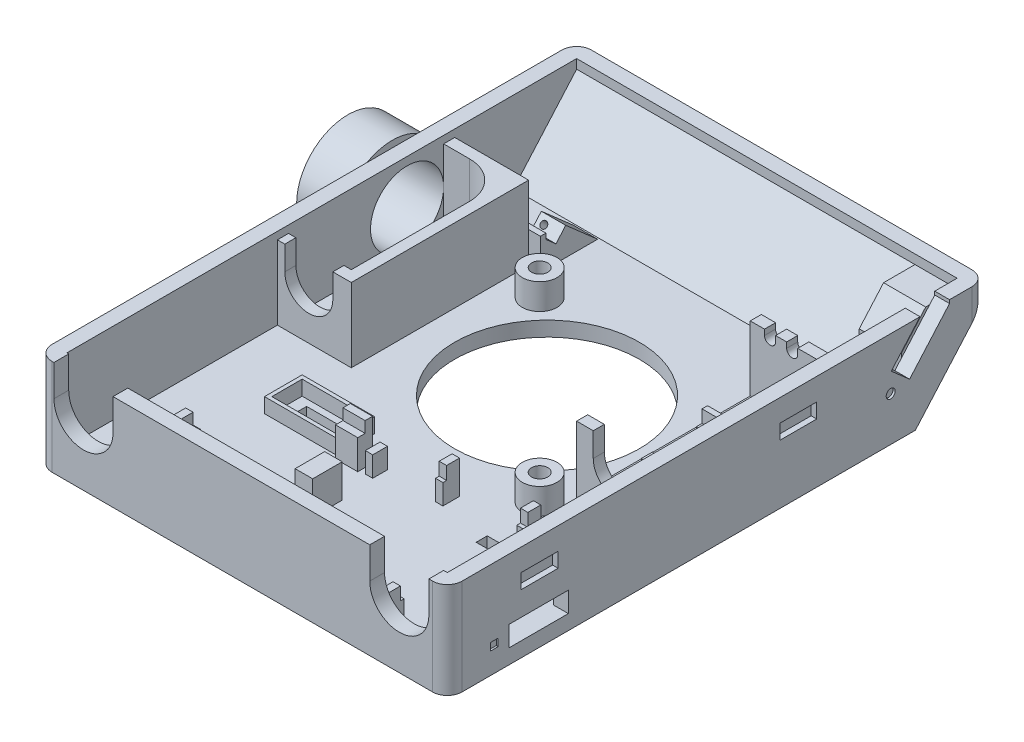
from build123d import *

# Parameters (mm, degrees)
SKETCH1_W            = 55.5
SKETCH1_H            = 73
BOSS_EXTRUDE1_DEPTH  = 13
CUT_EXTRUDE16_DEPTH  = 68.68677862
FILLET1_R            = 2
SHELL1_START         = -25.75
SHELL1_DEPTH         = 51.5
SKETCH3_W            = 10
SKETCH3_H            = 1.5
BOSS_EXTRUDE2_DEPTH  = 10
SKETCH4_W            = 1
SKETCH4_H            = 22
BOSS_EXTRUDE3_DEPTH  = 1.2
SKETCH5_R            = 2.35
SKETCH5_R_2          = 1.1
BOSS_EXTRUDE4_DEPTH  = 3.5
SKETCH8_W            = 1
SKETCH8_H            = 0.5
SKETCH8_H_2          = 2
BOSS_EXTRUDE7_DEPTH  = 2.75
SKETCH46_W           = 2.37743513
SKETCH46_H           = 4
SKETCH46_W_2         = 1
SKETCH46_H_2         = 1.75
BOSS_EXTRUDE24_DEPTH = 4.5
CUT_EXTRUDE1_DEPTH   = 10.1
SKETCH47_W           = 2
SKETCH47_H           = 1.5
CUT_EXTRUDE14_DEPTH  = 4.5
SKETCH14_W           = 3.4
SKETCH14_H           = 1.5
BOSS_EXTRUDE11_DEPTH = 5.05
SKETCH15_W           = 3.4
SKETCH15_H           = 0.75
BOSS_EXTRUDE12_DEPTH = 1.7
BOSS_EXTRUDE14_REACH = 49.395
CUT_EXTRUDE5_DEPTH   = 1.5
SKETCH22_R           = 4.95
CUT_EXTRUDE6_DEPTH   = 2
SKETCH44_R           = 6.95
SKETCH44_R_2         = 4.95
BOSS_EXTRUDE23_DEPTH = 6
FILLET9_R            = 5
CUT_EXTRUDE8_DEPTH   = 1.5
SKETCH29_R           = 12.5
CUT_EXTRUDE9_DEPTH   = 10
SKETCH43_W           = 3
SKETCH43_H           = 1
SKETCH43_W_2         = 1
SKETCH43_H_2         = 3
BOSS_EXTRUDE22_DEPTH = 4
FILLET10_R           = 0.5
SKETCH48_W           = 1
SKETCH48_H           = 3
SKETCH48_W_2         = 3
SKETCH48_H_2         = 1
BOSS_EXTRUDE25_DEPTH = 5.5
SKETCH50_W           = 9.8
SKETCH50_H           = 5.1
SKETCH50_W_2         = 8.8
SKETCH50_H_2         = 4.1
BOSS_EXTRUDE26_DEPTH = 2
SKETCH51_W           = 5.8
SKETCH51_H           = 2.3
CUT_EXTRUDE15_DEPTH  = 52.116753614
BOSS_EXTRUDE27_DEPTH = 43.2
CUT_EXTRUDE17_START  = -11
SKETCH55_W           = 36.6
SKETCH55_H           = 7.745558666
CUT_EXTRUDE17_DEPTH  = 4.215406
CUT_EXTRUDE18_START  = -17.45
CUT_EXTRUDE18_DEPTH  = 37.5
CUT_EXTRUDE19_DEPTH  = 2
CUT_EXTRUDE20_DEPTH  = 43.2
SKETCH41_R           = 0.60795749
CUT_EXTRUDE12_DEPTH  = 0.3
SKETCH59_W           = 1
SKETCH59_H           = 1
CUT_EXTRUDE21_DEPTH  = 0.25
SKETCH60_W           = 5
SKETCH60_H           = 2
CUT_EXTRUDE22_DEPTH  = 0.75
SKETCH61_W           = 5
SKETCH61_H           = 2
CUT_EXTRUDE23_DEPTH  = 0.75
SKETCH62_R           = 0.45
CUT_EXTRUDE24_DEPTH  = 1.5
CUT_EXTRUDE25_DEPTH  = 1.5


# Read off the part's stored shape, not the designer's step: Shell1, Cut-Extrude18
with BuildPart() as part:
    # Sketch1 → Boss-Extrude1 (new body)
    with BuildSketch(Plane(origin=(0, 0, 0), x_dir=(1, 0, 0), z_dir=(0, 1, 0))):
        Rectangle(SKETCH1_W, SKETCH1_H)
    extrude(amount=BOSS_EXTRUDE1_DEPTH)

    # Sketch52 → Cut-Extrude16 (cut, through all)
    with BuildSketch(Plane(origin=(27.75, 0, 0), x_dir=(0, 0, -1), z_dir=(1, 0, 0))):
        Polygon((26.85286282, 0), (36.5, 11), (36.5, 0), align=None)
    extrude(amount=-CUT_EXTRUDE16_DEPTH, mode=Mode.SUBTRACT)

    # Fillet1
    fillet1_edges = [part.edges().sort_by_distance(p)[0] for p in [
        (27.75, 6.5, 36.5),
        (-27.75, 6.5, 36.5),
        (-27.75, 12, -36.5),
        (27.75, 12, -36.5),
    ]]
    fillet(fillet1_edges, radius=FILLET1_R)

    # Shell1 outline → Shell1 (cut)
    with BuildSketch(Plane.YZ.offset(SHELL1_START)):
        Polygon((11.752769935, -34.5), (13, -34.5), (13, 34.5), (2, 34.5), (2, -25.946699141), align=None)
    extrude(amount=SHELL1_DEPTH, mode=Mode.SUBTRACT)

    # Sketch3 → Boss-Extrude2 (add)
    with BuildSketch(Plane(origin=(0, 2, 0), x_dir=(1, 0, 0), z_dir=(0, 1, 0))):
        with Locations((20.75, 17.25)):
            Rectangle(SKETCH3_W, SKETCH3_H)
        with Locations((20.75, -6.25)):
            Rectangle(SKETCH3_W, SKETCH3_H)
    extrude(amount=BOSS_EXTRUDE2_DEPTH)

    # Sketch4 → Boss-Extrude3 (add)
    with BuildSketch(Plane(origin=(0, 2, 0), x_dir=(1, 0, 0), z_dir=(0, 1, 0))):
        with Locations((16.25, 5.5)):
            Rectangle(SKETCH4_W, SKETCH4_H)
    extrude(amount=BOSS_EXTRUDE3_DEPTH)

    # Sketch5 → Boss-Extrude4 (add)
    # profile 1 of 2: a face of its own
    with BuildSketch(Plane(origin=(0, 2, 0), x_dir=(1, 0, 0), z_dir=(0, 1, 0))):
        with Locations(Location((-11.25, 15, 0), (0, 0, 90))):
            Circle(SKETCH5_R)
        with Locations(Location((-11.25, 15, 0), (0, 0, 270))):
            Circle(SKETCH5_R_2, mode=Mode.SUBTRACT)
    # profile 2 of 2: a face of its own
    with BuildSketch(Plane(origin=(0, 2, 0), x_dir=(1, 0, 0), z_dir=(0, 1, 0))):
        with Locations(Location((12.75, -9, 0), (0, 0, 90))):
            Circle(SKETCH5_R)
        with Locations(Location((12.75, -9, 0), (0, 0, 270))):
            Circle(SKETCH5_R_2, mode=Mode.SUBTRACT)
    extrude(amount=BOSS_EXTRUDE4_DEPTH)

    # Sketch8 → Boss-Extrude7 (add)
    with BuildSketch(Plane(origin=(0, 2, 0), x_dir=(1, 0, 0), z_dir=(0, 1, 0))):
        with Locations((17.15, -32.5)):
            Rectangle(SKETCH8_W, SKETCH8_H)
        with Locations((17.15, -15.75)):
            Rectangle(SKETCH8_W, SKETCH8_H)
        with Locations((6.15, -32.5)):
            Rectangle(SKETCH8_W, SKETCH8_H)
        with Locations((6.15, -15.75)):
            Rectangle(SKETCH8_W, SKETCH8_H)
        with Locations((-1.85, -16.5)):
            Rectangle(SKETCH8_W, SKETCH8_H_2)
        with Locations((-1.85, -31.75)):
            Rectangle(SKETCH8_W, SKETCH8_H_2)
    extrude(amount=BOSS_EXTRUDE7_DEPTH)

    # Sketch46 → Boss-Extrude24 (add)
    with BuildSketch(Plane(origin=(0, 2, 0), x_dir=(1, 0, 0), z_dir=(0, 1, 0))):
        with Locations((-2.038717565, -24.125)):
            Rectangle(SKETCH46_W, SKETCH46_H)
        with Locations((17.15, -14.625)):
            Rectangle(SKETCH46_W_2, SKETCH46_H_2)
        with Locations((6.15, -14.625)):
            Rectangle(SKETCH46_W_2, SKETCH46_H_2)
        with Locations((17.15, -33.625)):
            Rectangle(SKETCH46_W_2, SKETCH46_H_2)
        with Locations((6.15, -33.625)):
            Rectangle(SKETCH46_W_2, SKETCH46_H_2)
    extrude(amount=BOSS_EXTRUDE24_DEPTH)

    # Sketch10 → Cut-Extrude1 (cut)
    with BuildSketch(Plane(origin=(17.65, 0, 0), x_dir=(0, 0, -1), z_dir=(1, 0, 0))):
        Polygon((-24.125, 2), (-20.125, 2), (-20.125, 4.75), (-28.125, 4.75), (-28.125, 2), align=None)
    extrude(amount=CUT_EXTRUDE1_DEPTH, mode=Mode.SUBTRACT)

    # Sketch47 → Cut-Extrude14 (cut)
    with BuildSketch(Plane(origin=(0, 2, 0), x_dir=(-1, 0, 0), z_dir=(0, 1, 0))):
        with Locations((-18.65, 17.25)):
            Rectangle(SKETCH47_W, SKETCH47_H)
        with Locations((-14.15, 17.25)):
            Rectangle(SKETCH47_W, SKETCH47_H)
    extrude(amount=-CUT_EXTRUDE14_DEPTH, mode=Mode.SUBTRACT)

    # Sketch14 → Boss-Extrude11 (add)
    with BuildSketch(Plane(origin=(0, 2, 0), x_dir=(1, 0, 0), z_dir=(0, 1, 0))):
        with Locations((21.25, 6.173215069)):
            Rectangle(SKETCH14_W, SKETCH14_H)
    extrude(amount=BOSS_EXTRUDE11_DEPTH)

    # Sketch15 → Boss-Extrude12 (add)
    with BuildSketch(Plane(origin=(0, 7.05, 0), x_dir=(1, 0, 0), z_dir=(0, 1, 0))):
        with Locations((21.25, 6.548215069)):
            Rectangle(SKETCH15_W, SKETCH15_H)
    extrude(amount=BOSS_EXTRUDE12_DEPTH)

    # Sketch20 → Boss-Extrude14 (add, up to next)
    with BuildSketch(Plane(origin=(0, 12, 0), x_dir=(1, 0, 0), z_dir=(0, 1, 0)), mode=Mode.PRIVATE) as boss_extrude14_sk1:
        Polygon((-25.75, -6), (-15.75, -6), (-15.75, 18), (-25.75, 18), (-25.75, 16.5), (-17.25, 16.5), (-17.25, -4.5), (-25.75, -4.5), align=None)
    boss_extrude14_tool1 = extrude(boss_extrude14_sk1.sketch, amount=-BOSS_EXTRUDE14_REACH, mode=Mode.PRIVATE) - part.part
    add(boss_extrude14_tool1.solids().sort_by_distance((-20.75, 12, 5.74))[0])

    # Sketch19 → Cut-Extrude5 (cut)
    with BuildSketch(Plane(origin=(-8.28106392, 0, 4.5), x_dir=(-1, 0, 0), z_dir=(0, 0, -1))):
        with BuildLine():
            Line((9.96893608, 8.75), (9.96893608, 13))
            Line((9.96893608, 13), (16.46893608, 13))
            Line((16.46893608, 13), (16.46893608, 8.75))
            ThreePointArc((16.46893608, 8.75), (13.21893608, 5.5), (9.96893608, 8.75))
        make_face()
    extrude(amount=-CUT_EXTRUDE5_DEPTH, mode=Mode.SUBTRACT)

    # Sketch22 → Cut-Extrude6 (cut)
    with BuildSketch(Plane(origin=(-25.75, 0, 0), x_dir=(0, 0, -1), z_dir=(1, 0, 0))):
        with Locations((11.55, 6.95)):
            Circle(SKETCH22_R)
    extrude(amount=-CUT_EXTRUDE6_DEPTH, mode=Mode.SUBTRACT)

    # Sketch44 → Boss-Extrude23 (add)
    with BuildSketch(Plane.ZY.offset(27.75)):
        with Locations(Location((-11.55, 6.95, 0), (0, 0, 119.482786437))):
            Circle(SKETCH44_R)
        with Locations(Location((-11.55, 6.95, 0), (0, 0, 180))):
            Circle(SKETCH44_R_2, mode=Mode.SUBTRACT)
    extrude(amount=BOSS_EXTRUDE23_DEPTH)

    # Fillet9
    fillet9_edges = [part.edges().sort_by_distance(p)[0] for p in [
        (-17.25, 7, -16.5),
    ]]
    fillet(fillet9_edges, radius=FILLET9_R)

    # Sketch27 → Cut-Extrude8 (cut)
    with BuildSketch(Plane.XY.offset(5.5)):
        with BuildLine():
            Line((18, 8.75), (18, 12))
            Line((18, 12), (24.5, 12))
            Line((24.5, 12), (24.5, 8.75))
            ThreePointArc((24.5, 8.75), (21.25, 5.5), (18, 8.75))
        make_face()
    extrude(amount=CUT_EXTRUDE8_DEPTH, mode=Mode.SUBTRACT)

    # Sketch29 → Cut-Extrude9 (cut)
    with BuildSketch(Plane(origin=(0, 2, 0), x_dir=(1, 0, 0), z_dir=(0, 1, 0))):
        with Locations(Location((0.74, 4, 0), (0, 0, 270))):
            Circle(SKETCH29_R)
    extrude(amount=-CUT_EXTRUDE9_DEPTH, mode=Mode.SUBTRACT)

    # Sketch43 → Boss-Extrude22 (add)
    with BuildSketch(Plane(origin=(0, 2, 0), x_dir=(1, 0, 0), z_dir=(0, 1, 0))):
        with Locations((-10.838830042, -34)):
            Rectangle(SKETCH43_W, SKETCH43_H)
        with Locations((-4.626489251, -17.25)):
            Rectangle(SKETCH43_W, SKETCH43_H)
        with Locations((-15.25, -28.915109251)):
            Rectangle(SKETCH43_W_2, SKETCH43_H_2)
        with Locations((10.838830042, -34)):
            Rectangle(SKETCH43_W, SKETCH43_H)
    extrude(amount=BOSS_EXTRUDE22_DEPTH)

    # Fillet10
    fillet10_edges = [part.edges().sort_by_distance(p)[0] for p in [
        (-33.75, 6.95, -6.6),
    ]]
    fillet(fillet10_edges, radius=FILLET10_R)

    # Sketch48 → Boss-Extrude25 (add)
    with BuildSketch(Plane(origin=(0, 2, 0), x_dir=(1, 0, 0), z_dir=(0, 1, 0))):
        with Locations((-16.25, -28.915109251)):
            Rectangle(SKETCH48_W, SKETCH48_H)
        with Locations((-4.626489251, -16.25)):
            Rectangle(SKETCH48_W_2, SKETCH48_H_2)
    extrude(amount=BOSS_EXTRUDE25_DEPTH)

    # Sketch50 → Boss-Extrude26 (add)
    with BuildSketch(Plane(origin=(0, 2, 0), x_dir=(1, 0, 0), z_dir=(0, 1, 0))):
        with Locations((-11.35, -14.7)):
            Rectangle(SKETCH50_W, SKETCH50_H)
        with Locations((-11.35, -14.7)):
            Rectangle(SKETCH50_W_2, SKETCH50_H_2, mode=Mode.SUBTRACT)
    extrude(amount=BOSS_EXTRUDE26_DEPTH)

    # Sketch51 → Cut-Extrude15 (cut, through all)
    with BuildSketch(Plane(origin=(0, 2, 0), x_dir=(1, 0, 0), z_dir=(0, 1, 0))):
        with Locations((-11.35, -14.7)):
            Rectangle(SKETCH51_W, SKETCH51_H)
    extrude(amount=-CUT_EXTRUDE15_DEPTH, mode=Mode.SUBTRACT)

    # Sketch54 → Boss-Extrude27 (add)
    with BuildSketch(Plane(origin=(25.75, 0, 0), x_dir=(0, 0, -1), z_dir=(1, 0, 0))):
        Polygon((18, 2), (18, 6.21540617), (18.74828114, 6.21540617), (18.74828114, 5.467125029), (20.101568637, 4.280275018), (21.42494375, 5.789233163), (25.745558666, 2), align=None)
        Polygon((26.949488918, 7.993637998), (26.949488918, 3.143415642), (34.5, 11.752769935), (30.246294507, 11.752769935), align=None)
    extrude(amount=-BOSS_EXTRUDE27_DEPTH)

    # Sketch55 → Cut-Extrude17 (cut)
    with BuildSketch(Plane(origin=(0, 13, 0), x_dir=(1, 0, 0), z_dir=(0, 1, 0)).offset(CUT_EXTRUDE17_START)):
        with Locations((4.15, 21.872779333)):
            Rectangle(SKETCH55_W, SKETCH55_H)
    extrude(amount=CUT_EXTRUDE17_DEPTH, mode=Mode.SUBTRACT)

    # Cut-Extrude18 outline → Cut-Extrude18 (cut)
    with BuildSketch(Plane.YZ.offset(CUT_EXTRUDE18_START)):
        Polygon((3.143415642, -26.949488918), (11.752769935, -34.5), (11.752769935, -30.246294507), (7.993637998, -26.949488918), align=None)
    extrude(amount=CUT_EXTRUDE18_DEPTH, mode=Mode.SUBTRACT)

    # Sketch57 → Cut-Extrude19 (cut)
    with BuildSketch(Plane(origin=(27.75, 0, 0), x_dir=(0, 0, -1), z_dir=(1, 0, 0))):
        Polygon((28.992984923, 14.721899796), (23.586223758, 8.55692342), (26.067250836, 6.381031732), (31.474012001, 12.546008108), (31.474012001, 13), (29.218040093, 14.978515497), align=None)
    extrude(amount=-CUT_EXTRUDE19_DEPTH, mode=Mode.SUBTRACT)

    # Sketch58 → Cut-Extrude20 (cut)
    with BuildSketch(Plane(origin=(0, 0, 34.5), x_dir=(-1, 0, 0), z_dir=(0, 0, -1))):
        with BuildLine():
            Line((-25.25, 8.75), (-25.25, 13))
            Line((-25.25, 13), (-17.25, 13))
            Line((-17.25, 13), (-17.25, 8.75))
            ThreePointArc((-17.25, 8.75), (-21.25, 4.75), (-25.25, 8.75))
        make_face()
        with BuildLine():
            Line((17.5, 8.75), (17.5, 13))
            Line((17.5, 13), (25.5, 13))
            Line((25.5, 13), (25.5, 8.75))
            ThreePointArc((25.5, 8.75), (21.5, 4.75), (17.5, 8.75))
        make_face()
    extrude(amount=-CUT_EXTRUDE20_DEPTH, mode=Mode.SUBTRACT)

    # Sketch41 → Cut-Extrude12 (cut)
    with BuildSketch(Plane(origin=(27.75, 0, 0), x_dir=(0, 0, -1), z_dir=(1, 0, 0))):
        with Locations((23.508015062, 5.965324801)):
            Circle(SKETCH41_R)
    extrude(amount=-CUT_EXTRUDE12_DEPTH, mode=Mode.SUBTRACT)

    # Sketch59 → Cut-Extrude21 (cut)
    with BuildSketch(Plane(origin=(27.75, 0, 0), x_dir=(0, 0, -1), z_dir=(1, 0, 0))):
        with Locations((-30.125, 3.375)):
            Rectangle(SKETCH59_W, SKETCH59_H)
    extrude(amount=-CUT_EXTRUDE21_DEPTH, mode=Mode.SUBTRACT)

    # Sketch60 → Cut-Extrude22 (cut)
    with BuildSketch(Plane(origin=(27.75, 0, 0), x_dir=(0, 0, -1), z_dir=(1, 0, 0))):
        with Locations((-24, 9)):
            Rectangle(SKETCH60_W, SKETCH60_H)
        with Locations((11, 9)):
            Rectangle(SKETCH60_W, SKETCH60_H)
    extrude(amount=-CUT_EXTRUDE22_DEPTH, mode=Mode.SUBTRACT)

    # Sketch61 → Cut-Extrude23 (cut)
    with BuildSketch(Plane.ZY.offset(27.75)):
        with Locations((6.5, 9)):
            Rectangle(SKETCH61_W, SKETCH61_H)
    extrude(amount=-CUT_EXTRUDE23_DEPTH, mode=Mode.SUBTRACT)

    # Sketch62 → Cut-Extrude24 (cut)
    with BuildSketch(Plane(origin=(0, -8.103971978, -9.240429579), x_dir=(1, 0, 0), z_dir=(0, 0.6593611176072455, 0.7518263872648554))):
        with Locations(Location((-16.450006225, 17.472216465, 0), (0, 0, 270))):
            Circle(SKETCH62_R)
    extrude(amount=-CUT_EXTRUDE24_DEPTH, mode=Mode.SUBTRACT)

    # Sketch63 → Cut-Extrude25 (cut)
    with BuildSketch(Plane(origin=(0, 0, -18), x_dir=(-1, 0, 0), z_dir=(0, 0, -1))):
        with BuildLine():
            Line((-17.678764981, 11.25), (-17.678764981, 12))
            Line((-17.678764981, 12), (-19.178764981, 12))
            Line((-19.178764981, 12), (-19.178764981, 11.25))
            ThreePointArc((-19.178764981, 11.25), (-18.428764981, 10.5), (-17.678764981, 11.25))
        make_face()
        with BuildLine():
            Line((-20.678764981, 11.25), (-20.678764981, 12))
            Line((-20.678764981, 12), (-22.178764981, 12))
            Line((-22.178764981, 12), (-22.178764981, 11.25))
            ThreePointArc((-22.178764981, 11.25), (-21.428764981, 10.5), (-20.678764981, 11.25))
        make_face()
    extrude(amount=-CUT_EXTRUDE25_DEPTH, mode=Mode.SUBTRACT)


solid = part.part
